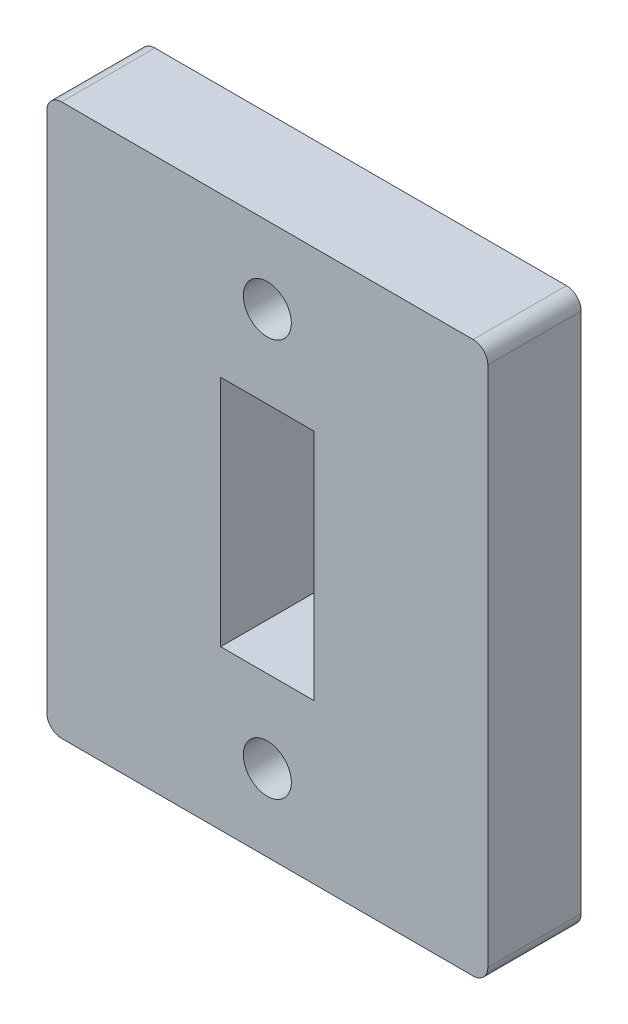
from build123d import *

# Parameters (mm, degrees)
SKETCH1_W                                        = 60
SKETCH1_H                                        = 75
BOSS_EXTRUDE1_DEPTH                              = 12.7
CSK_FOR_1_4_FLAT_HEAD_MACHINE_SCREW1_D           = 6.5278
CSK_FOR_1_4_FLAT_HEAD_MACHINE_SCREW1_CSINK_D     = 12.8778
CSK_FOR_1_4_FLAT_HEAD_MACHINE_SCREW1_CSINK_ANGLE = 82
FILLET1_R                                        = 2


with BuildPart() as part:
    # Sketch1 → Boss-Extrude1 (new body)
    with BuildSketch(Plane.XY):
        with Locations((30, -37.5)):
            Rectangle(SKETCH1_W, SKETCH1_H)
        Polygon((30, -21.625), (36.35, -21.625), (36.35, -53.375), (30, -53.375), (23.65, -53.375), (23.65, -21.625), align=None, mode=Mode.SUBTRACT)
    extrude(amount=BOSS_EXTRUDE1_DEPTH)

    # CSK for 1/4 Flat Head Machine Screw1 (through all)
    with Locations(Plane(origin=(0, 0, 0), x_dir=(-1, 0, 0), z_dir=(0, 0, -1))):
        with Locations((-30, -10.44), (-30, -64.56)):
            CounterSinkHole(CSK_FOR_1_4_FLAT_HEAD_MACHINE_SCREW1_D / 2, CSK_FOR_1_4_FLAT_HEAD_MACHINE_SCREW1_CSINK_D / 2, counter_sink_angle=CSK_FOR_1_4_FLAT_HEAD_MACHINE_SCREW1_CSINK_ANGLE)

    # Fillet1
    fillet1_edges = [part.edges().sort_by_distance(p)[0] for p in [
        (0, 0, 6.35),
        (60, 0, 6.35),
        (0, -75, 6.35),
        (60, -75, 6.35),
    ]]
    fillet(fillet1_edges, radius=FILLET1_R)


solid = part.part
